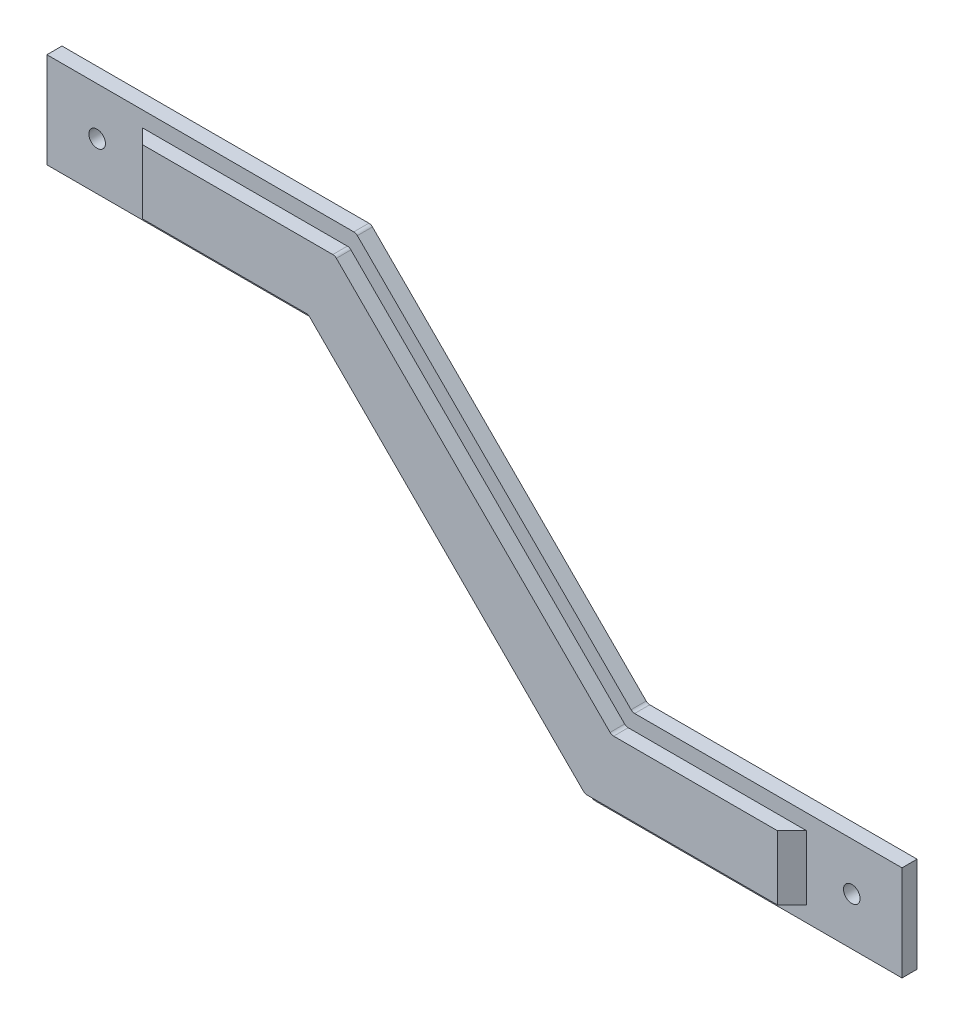
from build123d import *

# Parameters (mm, degrees)
SKETCH_1_R      = 1.65
EXTRUDE_1_DEPTH = 3
EXTRUDE_2_DEPTH = 2.9
CHAMFER_1_SIZE  = 2.9
FILLET_1_R      = 1


with BuildPart() as part:
    # 草图1 → 凸台-拉伸1 (new body)
    with BuildSketch(Plane.XY):
        Polygon((-85.15, 37.05), (-23.614971157, 37.05), (31.485028843, -18.05), (85.15, -18.05), (85.15, -37.05), (23.614971157, -37.05), (-31.485028843, 18.05), (-85.15, 18.05), align=None)
        with Locations((-75.15, 27.55)):
            Circle(SKETCH_1_R, mode=Mode.SUBTRACT)
        with Locations((75.15, -27.55)):
            Circle(SKETCH_1_R, mode=Mode.SUBTRACT)
    extrude(amount=EXTRUDE_1_DEPTH)

    # 草图2 → 凸台-拉伸2 (add)
    with BuildSketch(Plane.XY.offset(3)):
        Polygon((-66.15, 33.95), (-66.15, 21.15), (-30.200966799, 21.15), (24.899033201, -33.95), (66.15, -33.95), (66.15, -21.15), (30.200966799, -21.15), (-24.899033201, 33.95), align=None)
    extrude(amount=EXTRUDE_2_DEPTH)

    # 倒角1
    chamfer_1_edges = [part.edges().sort_by_distance(p)[0] for p in [
        (66.15, -27.55, 5.9),
        (-66.15, 27.55, 5.9),
    ]]
    chamfer(chamfer_1_edges, length=CHAMFER_1_SIZE - 0.0001)  # a hair under: the kernel refuses the full size

    # 圆角1
    fillet_1_edges = [part.edges().sort_by_distance(p)[0] for p in [
        (-23.614971157, 37.05, 1.5),
        (31.485028843, -18.05, 1.5),
        (23.614971157, -37.05, 1.5),
        (-31.485028843, 18.05, 1.5),
        (-24.899033201, 33.95, 4.45),
        (-30.200966799, 21.15, 4.45),
        (24.899033201, -33.95, 4.45),
        (30.200966799, -21.15, 4.45),
    ]]
    fillet(fillet_1_edges, radius=FILLET_1_R)


solid = part.part
